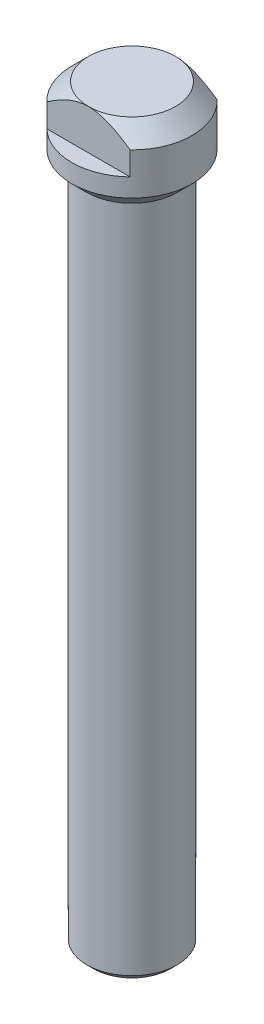
from build123d import *

# Parameters (mm, degrees)
CUT_EXTRUDE_START   = -12
CUT_EXTRUDE_1_DEPTH = 12
CUT_EXTRUDE_2_DEPTH = 12
CHAMFER_1_SIZE      = 5
CHAMFER_2_SIZE      = 2


with BuildPart() as part:
    # Эскиз1 → Повернуть1 (revolve)
    with BuildSketch(Plane(origin=(0, 0, 0), x_dir=(-1, 0, 0), z_dir=(0, 0, -1)), mode=Mode.PRIVATE) as revolve_1_sk:
        Polygon((-13.5, -224), (0, -224), (0, 0), (-18, 0), (-18, -17.5), (-13.5, -22), align=None)
    revolve(revolve_1_sk.sketch.rotate(Axis((0, -224, 0), (0, 1, 0)), 270), axis=Axis((0, -224, 0), (0, 1, 0)))

    # Эскиз2 → Вырез-Вытянуть1 (cut)
    with BuildSketch(Plane(origin=(0, 0, 0), x_dir=(-1, 0, 0), z_dir=(0, 1, 0)).offset(CUT_EXTRUDE_START)):
        with BuildLine():
            Line((-12.449899598, 13), (12.449899598, 13))
            ThreePointArc((12.449899598, 13), (0, 18), (-12.449899598, 13))
        make_face()
    extrude(amount=CUT_EXTRUDE_1_DEPTH, mode=Mode.SUBTRACT)

    # Эскиз3 → Вырез-Вытянуть2 (cut)
    with BuildSketch(Plane(origin=(0, 0, 0), x_dir=(-1, 0, 0), z_dir=(0, 1, 0)).offset(CUT_EXTRUDE_START)):
        with BuildLine():
            Line((12.449899598, -13), (-12.449899598, -13))
            ThreePointArc((-12.449899598, -13), (0, -18), (12.449899598, -13))
        make_face()
    extrude(amount=CUT_EXTRUDE_2_DEPTH, mode=Mode.SUBTRACT)

    # Фаска1
    chamfer_1_edges = [part.edges().sort_by_distance(p)[0] for p in [
        (-18, 0, 0),
        (18, 0, 0),
    ]]
    chamfer(chamfer_1_edges, length=CHAMFER_1_SIZE - 0.0001)  # a hair under: the kernel refuses the full size

    # Фаска2
    chamfer_2_edges = [part.edges().sort_by_distance(p)[0] for p in [
        (0, -224, -13.5),
    ]]
    chamfer(chamfer_2_edges, length=CHAMFER_2_SIZE)


solid = part.part
